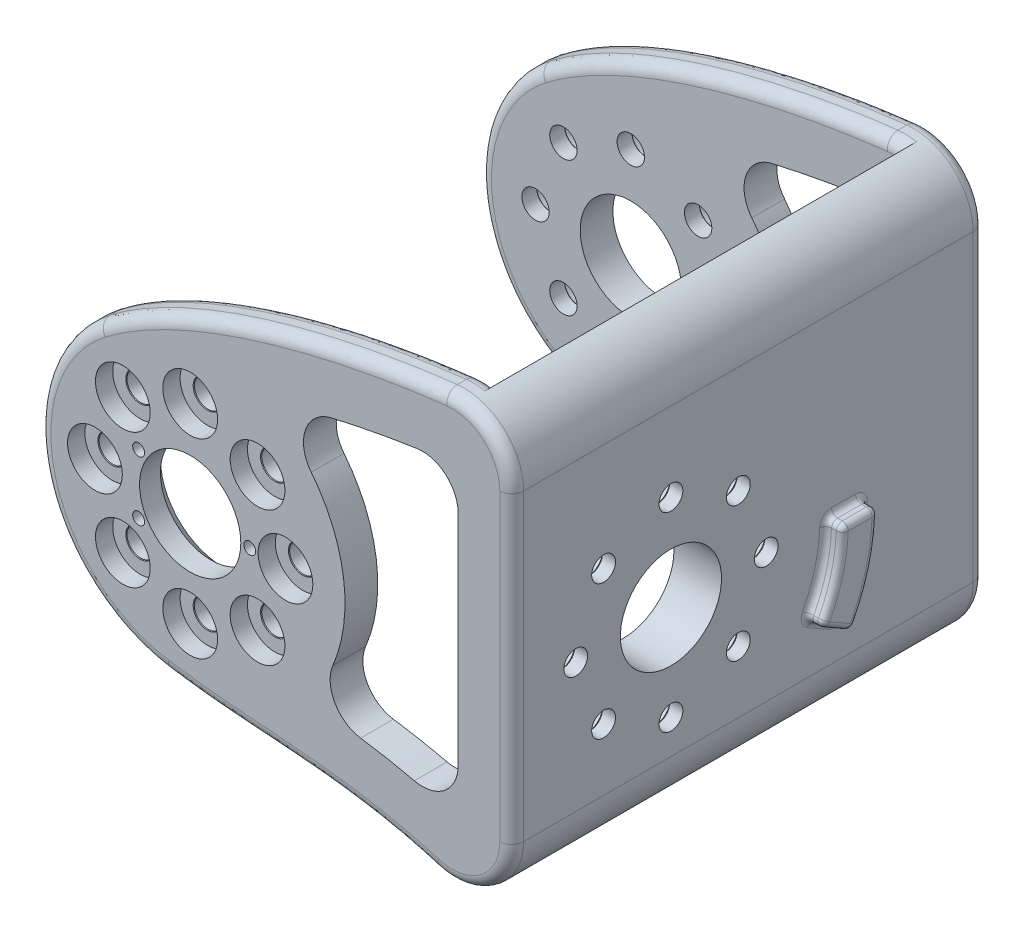
from build123d import *

# Parameters (mm, degrees)
BOSS_EXTRUDE1_DEPTH                          = 19.875
SHELL1_START                                 = -12.7000001
SHELL1_OUTLINE_W                             = 39
SHELL1_OUTLINE_H                             = 34.25
SHELL1_DEPTH                                 = 35.7000001
CBORE_FOR_M2_HEX_SOCKET_HEAD_CAP_SCR_2_COUNT = 2
CBORE_FOR_M2_HEX_SOCKET_HEAD_CAP_SCR_2_PITCH = 6.122934918
CBORE_FOR_M2_HEX_SOCKET_HEAD_CAP_SCR_3_COUNT = 2
CBORE_FOR_M2_HEX_SOCKET_HEAD_CAP_SCR_3_PITCH = 11.313708499
CBORE_FOR_M2_HEX_SOCKET_HEAD_CAP_SCR_4_COUNT = 2
CBORE_FOR_M2_HEX_SOCKET_HEAD_CAP_SCR_4_PITCH = 14.78207252
CBORE_FOR_M2_HEX_SOCKET_HEAD_CAP_SCR_5_COUNT = 2
CBORE_FOR_M2_HEX_SOCKET_HEAD_CAP_SCR_5_PITCH = 16
CBORE_FOR_M2_HEX_SOCKET_HEAD_CAP_SCR_6_COUNT = 2
CBORE_FOR_M2_HEX_SOCKET_HEAD_CAP_SCR_6_PITCH = 6.122934918
CBORE_FOR_M2_HEX_SOCKET_HEAD_CAP_SCR_7_COUNT = 2
CBORE_FOR_M2_HEX_SOCKET_HEAD_CAP_SCR_7_PITCH = 11.313708499
CBORE_FOR_M2_HEX_SOCKET_HEAD_CAP_SCR_8_COUNT = 2
CBORE_FOR_M2_HEX_SOCKET_HEAD_CAP_SCR_8_PITCH = 14.78207252
SKETCH27_R                                   = 0.5
CUT_EXTRUDE10_DEPTH                          = 1
CUT_EXTRUDE17_DEPTH                          = 40.038642886
CUT_EXTRUDE17_DEPTH_BACK                     = 40.038642886
SKETCH35_R                                   = 4.25
CUT_EXTRUDE4_REACH                           = 50.694
SKETCH10_R                                   = 4.25
SKETCH28_R                                   = 0.4
CUT_EXTRUDE11_DEPTH                          = 1
CUT_EXTRUDE15_DEPTH                          = 40.038642886
CUT_EXTRUDE15_DEPTH_BACK                     = 40.038642886
BOSS_EXTRUDE2_DEPTH                          = 1.4
FILLET34_R                                   = 5
FILLET36_R                                   = 0.5
FILLET30_R                                   = 3
CHAMFER1_SIZE                                = 1
FILLET35_R                                   = 1
FILLET37_R                                   = 0.5
POPY_WATERMARK_RIGHT_DEPTH                   = 1
SCALE1_SCALE                                 = 1.3
SCALE2_SCALE                                 = 1.05769


# Read off the part's stored shape, not the designer's step: Shell1, CBORE for M2 Hex Socket Head Cap Screw2
with BuildPart() as part:
    # Sketch4 → Boss-Extrude1 (new, symmetric)
    with BuildSketch(Plane.XY):
        with BuildLine():
            Line((27, -18), (27, 20))
            add(Edge.make_bspline(
                [(-7.730668476, 10.076049072), (2.170162487, 17.672284588), (21.370784375, 20), (27, 20)],
                knots=[0, 0, 0, 0, 1, 1, 1, 1], degree=3))
            ThreePointArc((-7.730668476, 10.076049072), (-12.308703382, -3.128229699), (-1.981723336, -12.544431937))
            add(Edge.make_bspline(
                [(-1.981723336, -12.544431937), (7.580415063, -14.055023481), (14.656713895, -12.657176609), (27, -18)],
                knots=[0, 0, 0, 0, 1, 1, 1, 1], degree=3))
        make_face()
    extrude(amount=BOSS_EXTRUDE1_DEPTH, both=True)

    # Shell1 outline → Shell1 (cut)
    with BuildSketch(Plane.YZ.offset(SHELL1_START)):
        with Locations((1.5, 0)):
            Rectangle(SHELL1_OUTLINE_W, SHELL1_OUTLINE_H)
    extrude(amount=SHELL1_DEPTH, mode=Mode.SUBTRACT)

    # Sketch5 → CBORE for M2 Hex Socket Head Cap Screw1 (revolve, cut)
    with BuildSketch(Plane(origin=(23, -5.656854249, 0.843145751), x_dir=(0, 0, 1), z_dir=(0, 1, 0))):
        Polygon((0, 0), (0, 4), (1, 4), (1, 2.9), (1.2, 2.7), (2.3, 2.7), (2.3, 0), align=None)
    cbore_for_m2_hex_socket_head_cap_screw1 = revolve(axis=Axis((16.65, -5.656854249, 0.843145751), (1, 0, 0)), mode=Mode.SUBTRACT)

    # CBORE for M2 Hex Socket Head Cap Scr 2: CBORE for M2 Hex Socket Head Cap Screw1 ×2
    with Locations(*[Vector(0, 0.923879532511287, -0.3826834323650894) * (i * CBORE_FOR_M2_HEX_SOCKET_HEAD_CAP_SCR_2_PITCH) for i in range(1, CBORE_FOR_M2_HEX_SOCKET_HEAD_CAP_SCR_2_COUNT)]):
        add(cbore_for_m2_hex_socket_head_cap_screw1, mode=Mode.SUBTRACT)

    # CBORE for M2 Hex Socket Head Cap Scr 3: CBORE for M2 Hex Socket Head Cap Screw1 ×2
    with Locations(*[(0, i * CBORE_FOR_M2_HEX_SOCKET_HEAD_CAP_SCR_3_PITCH, 0) for i in range(1, CBORE_FOR_M2_HEX_SOCKET_HEAD_CAP_SCR_3_COUNT)]):
        add(cbore_for_m2_hex_socket_head_cap_screw1, mode=Mode.SUBTRACT)

    # CBORE for M2 Hex Socket Head Cap Scr 4: CBORE for M2 Hex Socket Head Cap Screw1 ×2
    with Locations(*[Vector(0, 0.9238795325112865, 0.38268343236509034) * (i * CBORE_FOR_M2_HEX_SOCKET_HEAD_CAP_SCR_4_PITCH) for i in range(1, CBORE_FOR_M2_HEX_SOCKET_HEAD_CAP_SCR_4_COUNT)]):
        add(cbore_for_m2_hex_socket_head_cap_screw1, mode=Mode.SUBTRACT)

    # CBORE for M2 Hex Socket Head Cap Scr 5: CBORE for M2 Hex Socket Head Cap Screw1 ×2
    with Locations(*[Vector(0, 0.707106781186547, 0.707106781186548) * (i * CBORE_FOR_M2_HEX_SOCKET_HEAD_CAP_SCR_5_PITCH) for i in range(1, CBORE_FOR_M2_HEX_SOCKET_HEAD_CAP_SCR_5_COUNT)]):
        add(cbore_for_m2_hex_socket_head_cap_screw1, mode=Mode.SUBTRACT)

    # CBORE for M2 Hex Socket Head Cap Scr 6: CBORE for M2 Hex Socket Head Cap Screw1 ×2
    with Locations(*[Vector(0, -0.3826834323650897, 0.9238795325112868) * (i * CBORE_FOR_M2_HEX_SOCKET_HEAD_CAP_SCR_6_PITCH) for i in range(1, CBORE_FOR_M2_HEX_SOCKET_HEAD_CAP_SCR_6_COUNT)]):
        add(cbore_for_m2_hex_socket_head_cap_screw1, mode=Mode.SUBTRACT)

    # CBORE for M2 Hex Socket Head Cap Scr 7: CBORE for M2 Hex Socket Head Cap Screw1 ×2
    with Locations(*[(0, 0, i * CBORE_FOR_M2_HEX_SOCKET_HEAD_CAP_SCR_7_PITCH) for i in range(1, CBORE_FOR_M2_HEX_SOCKET_HEAD_CAP_SCR_7_COUNT)]):
        add(cbore_for_m2_hex_socket_head_cap_screw1, mode=Mode.SUBTRACT)

    # CBORE for M2 Hex Socket Head Cap Scr 8: CBORE for M2 Hex Socket Head Cap Screw1 ×2
    with Locations(*[Vector(0, 0.38268343236508934, 0.923879532511287) * (i * CBORE_FOR_M2_HEX_SOCKET_HEAD_CAP_SCR_8_PITCH) for i in range(1, CBORE_FOR_M2_HEX_SOCKET_HEAD_CAP_SCR_8_COUNT)]):
        add(cbore_for_m2_hex_socket_head_cap_screw1, mode=Mode.SUBTRACT)

    # CBORE for M2 Hex Socket Head Cap Scr 9 → CBORE for M2 Hex Socket Head Cap Screw2 (revolve, cut)
    with BuildSketch(Plane(origin=(-5.656854249, -5.656854249, 0), x_dir=(1, 0, 0), z_dir=(0, -1, 0))):
        Polygon((0, 17.125), (1.15, 17.125), (1.15, 18.375), (1.2, 18.425), (2.3, 18.425), (2.3, 19.875), (0, 19.875), align=None)
    cbore_for_m2_hex_socket_head_cap_screw2 = revolve(axis=Axis((-5.656854249, -5.656854249, 0), (0, 0, 1)), mode=Mode.SUBTRACT)

    # CBORE for M2 Hex Socket Head Cap Scr 11 → CBORE for M2 Hex Socket Head Cap Scr 10 (revolve, cut)
    with BuildSketch(Plane(origin=(-8, 0, 0), x_dir=(1, 0, 0), z_dir=(0, -1, 0))):
        Polygon((1.15, 18.375), (1.2, 18.425), (2.3, 18.425), (2.3, 19.875), (0, 19.875), (0, 17.125), (1.15, 17.125), align=None)
    cbore_for_m2_hex_socket_head_cap_scr_10 = revolve(axis=Axis((-8, 0, 0), (0, 0, 1)), mode=Mode.SUBTRACT)

    # CBORE for M2 Hex Socket Head Cap Scr 13 → CBORE for M2 Hex Socket Head Cap Scr 12 (revolve, cut)
    with BuildSketch(Plane(origin=(-5.656854249, 5.656854249, 0), x_dir=(1, 0, 0), z_dir=(0, -1, 0))):
        Polygon((1.15, 18.375), (1.2, 18.425), (2.3, 18.425), (2.3, 19.875), (0, 19.875), (0, 17.125), (1.15, 17.125), align=None)
    cbore_for_m2_hex_socket_head_cap_scr_12 = revolve(axis=Axis((-5.656854249, 5.656854249, 0), (0, 0, 1)), mode=Mode.SUBTRACT)

    # CBORE for M2 Hex Socket Head Cap Scr 15 → CBORE for M2 Hex Socket Head Cap Scr 14 (revolve, cut)
    with BuildSketch(Plane(origin=(8, 0, 0), x_dir=(1, 0, 0), z_dir=(0, -1, 0))):
        Polygon((1.15, 18.375), (1.2, 18.425), (2.3, 18.425), (2.3, 19.875), (0, 19.875), (0, 17.125), (1.15, 17.125), align=None)
    cbore_for_m2_hex_socket_head_cap_scr_14 = revolve(axis=Axis((8, 0, 0), (0, 0, 1)), mode=Mode.SUBTRACT)

    # CBORE for M2 Hex Socket Head Cap Scr 17 → CBORE for M2 Hex Socket Head Cap Scr 16 (revolve, cut)
    with BuildSketch(Plane(origin=(5.656854249, -5.656854249, 0), x_dir=(1, 0, 0), z_dir=(0, -1, 0))):
        Polygon((1.15, 18.375), (1.2, 18.425), (2.3, 18.425), (2.3, 19.875), (0, 19.875), (0, 17.125), (1.15, 17.125), align=None)
    cbore_for_m2_hex_socket_head_cap_scr_16 = revolve(axis=Axis((5.656854249, -5.656854249, 0), (0, 0, 1)), mode=Mode.SUBTRACT)

    # CBORE for M2 Hex Socket Head Cap Scr 19 → CBORE for M2 Hex Socket Head Cap Scr 18 (revolve, cut)
    with BuildSketch(Plane.XZ.offset(8)):
        Polygon((1.15, 18.375), (1.2, 18.425), (2.3, 18.425), (2.3, 19.875), (0, 19.875), (0, 17.125), (1.15, 17.125), align=None)
    cbore_for_m2_hex_socket_head_cap_scr_18 = revolve(axis=Axis((0, -8, 0), (0, 0, 1)), mode=Mode.SUBTRACT)

    # CBORE for M2 Hex Socket Head Cap Scr 21 → CBORE for M2 Hex Socket Head Cap Scr 20 (revolve, cut)
    with BuildSketch(Plane.XZ.offset(-8)):
        Polygon((1.15, 18.375), (1.2, 18.425), (2.3, 18.425), (2.3, 19.875), (0, 19.875), (0, 17.125), (1.15, 17.125), align=None)
    cbore_for_m2_hex_socket_head_cap_scr_20 = revolve(axis=Axis((0, 8, 0), (0, 0, 1)), mode=Mode.SUBTRACT)

    # CBORE for M2 Hex Socket Head Cap Scr 23 → CBORE for M2 Hex Socket Head Cap Scr 22 (revolve, cut)
    with BuildSketch(Plane(origin=(5.656854249, 5.656854249, 0), x_dir=(1, 0, 0), z_dir=(0, -1, 0))):
        Polygon((1.15, 18.375), (1.2, 18.425), (2.3, 18.425), (2.3, 19.875), (0, 19.875), (0, 17.125), (1.15, 17.125), align=None)
    cbore_for_m2_hex_socket_head_cap_scr_22 = revolve(axis=Axis((5.656854249, 5.656854249, 0), (0, 0, 1)), mode=Mode.SUBTRACT)

    # Sketch27 → Cut-Extrude10 (cut)
    with BuildSketch(Plane.XY.offset(19.875)):
        with Locations((-4.330127019, -2.5)):
            Circle(SKETCH27_R)
        with Locations((-4.330127019, 2.5)):
            Circle(SKETCH27_R)
        with Locations((5, 0)):
            Circle(SKETCH27_R)
    extrude(amount=-CUT_EXTRUDE10_DEPTH, mode=Mode.SUBTRACT)

    # Mirror2: CBORE for M2 Hex Socket Head Cap Screw2, CBORE for M2 Hex Socket Head Cap Scr 10, CBORE for M2 Hex Socket Head Cap Scr 12, CBORE for M2 Hex Socket Head Cap Scr 14, CBORE for M2 Hex Socket Head Cap Scr 16, CBORE for M2 Hex Socket Head Cap Scr 18, CBORE for M2 Hex Socket Head Cap Scr 20, CBORE for M2 Hex Socket Head Cap Scr 22 across plane
    add(cbore_for_m2_hex_socket_head_cap_screw2.mirror(Plane.XY), mode=Mode.SUBTRACT)
    add(cbore_for_m2_hex_socket_head_cap_scr_10.mirror(Plane.XY), mode=Mode.SUBTRACT)
    add(cbore_for_m2_hex_socket_head_cap_scr_12.mirror(Plane.XY), mode=Mode.SUBTRACT)
    add(cbore_for_m2_hex_socket_head_cap_scr_14.mirror(Plane.XY), mode=Mode.SUBTRACT)
    add(cbore_for_m2_hex_socket_head_cap_scr_16.mirror(Plane.XY), mode=Mode.SUBTRACT)
    add(cbore_for_m2_hex_socket_head_cap_scr_18.mirror(Plane.XY), mode=Mode.SUBTRACT)
    add(cbore_for_m2_hex_socket_head_cap_scr_20.mirror(Plane.XY), mode=Mode.SUBTRACT)
    add(cbore_for_m2_hex_socket_head_cap_scr_22.mirror(Plane.XY), mode=Mode.SUBTRACT)

    # Sketch35 → Cut-Extrude17 (cut, two sides: drawn at the far end of the back side and taken through both)
    with BuildSketch(Plane.XY.offset(-CUT_EXTRUDE17_DEPTH_BACK)):
        Circle(SKETCH35_R)
    extrude(amount=CUT_EXTRUDE17_DEPTH + CUT_EXTRUDE17_DEPTH_BACK, mode=Mode.SUBTRACT)

    # Sketch10 → Cut-Extrude4 (cut, up to next)
    with BuildSketch(Plane(origin=(27, 0, 0), x_dir=(0, 0, -1), z_dir=(1, 0, 0)), mode=Mode.PRIVATE) as cut_extrude4_sk1:
        with Locations((-6.5, 0)):
            Circle(SKETCH10_R)
    cut_extrude4_tool1 = extrude(cut_extrude4_sk1.sketch, amount=-CUT_EXTRUDE4_REACH, mode=Mode.PRIVATE) & part.part
    add(cut_extrude4_tool1.solids().sort_by_distance((27, 0, 6.5))[0], mode=Mode.SUBTRACT)

    # Sketch28 → Cut-Extrude11 (cut)
    with BuildSketch(Plane.ZY.offset(-23)):
        with Locations((4, 4.330127019)):
            Circle(SKETCH28_R)
        with Locations((6.5, -5)):
            Circle(SKETCH28_R)
        with Locations((9, 4.330127019)):
            Circle(SKETCH28_R)
    extrude(amount=-CUT_EXTRUDE11_DEPTH, mode=Mode.SUBTRACT)

    # Sketch33 → Cut-Extrude15 (cut, two sides: drawn at the far end of the back side and taken through both)
    with BuildSketch(Plane.XY.offset(-CUT_EXTRUDE15_DEPTH_BACK)):
        with BuildLine():
            Line((22.5, -11.00441019), (22.5, 14.703770704))
            add(Edge.make_bspline(
                [(22.5, 14.703770704), (19.97823315, 14.435188006), (17.478569984, 14.052501286), (13.840120773, 13.34454419), (12.686377133, 13.096488181), (10.388606277, 12.550217869), (9.243374868, 12.25169122), (7.498636488, 11.749344215), (6.894320921, 11.566457955), (6.293948625, 11.374805964)],
                knots=[-0.017703057, -0.017703057, -0.017703057, -0.017703057, 0.25, 0.25, 0.375, 0.375, 0.5, 0.5, 0.566833748, 0.566833748, 0.566833748, 0.566833748], degree=3))
            ThreePointArc((6.293948625, 11.374805964), (12.814173522, 2.190195644), (9.71463917, -8.638621754))
            add(Edge.make_bspline(
                [(9.71463917, -8.638621754), (9.975309464, -8.661139726), (10.235894851, -8.684549682), (12.446027973, -8.892631092), (14.383905745, -9.13940269), (18.390999465, -9.872923338), (20.457026256, -10.376791909), (22.5, -11.00441019)],
                knots=[0.46659928, 0.46659928, 0.46659928, 0.46659928, 0.5, 0.5, 0.75, 0.75, 1.022184537, 1.022184537, 1.022184537, 1.022184537], degree=3))
        make_face()
    extrude(amount=CUT_EXTRUDE15_DEPTH + CUT_EXTRUDE15_DEPTH_BACK, mode=Mode.SUBTRACT)

    # Sketch21 → Boss-Extrude2 (add)
    with BuildSketch(Plane(origin=(27, 0, 0), x_dir=(0, 0, -1), z_dir=(1, 0, 0))):
        with BuildLine():
            Line((9.5, 0), (6.5, 0))
            ThreePointArc((6.5, 0), (6.057035742, -3.364647586), (4.758330249, -6.5))
            Line((4.758330249, -6.5), (7.356406461, -8))
            ThreePointArc((7.356406461, -8), (8.954813221, -4.141104722), (9.5, 0))
        make_face()
    extrude(amount=BOSS_EXTRUDE2_DEPTH)

    # Fillet34
    # the kernel refuses this fillet: 5 mm, written as the material it takes off along each edge
    with BuildSketch(Plane(origin=(27, 20, 0), x_dir=(-0.9976427256817361, -0.06862209479691335, 0), z_dir=(0, 0, 1))) as fillet34_piece_1:
        with BuildLine():
            CenterArc((5.355410859, 4.99528158), FILLET34_R, 176.065151261, 96.424193771)
            Line((0.36719723, 5.338392054), (0.267432958, 5.345254263))
            Line((0.267432958, 5.345254263), (-0.099764273, 0.006862209))
            Line((-0.099764273, 0.006862209), (-0.006862209, -0.099764273))
            ThreePointArc((-0.006862209, -0.099764273), (2.787150186, -0.170501246), (5.576922215, -0.099905632))
            Line((5.576922215, -0.099905632), (5.572578855, 0))
        make_face()
    extrude(amount=33.806447138, mode=Mode.SUBTRACT)
    with BuildSketch(Plane(origin=(27, -18, 0), x_dir=(-0.9389575181326852, 0.34403310762498984, 0), z_dir=(0, 0, 1))) as fillet34_piece_2:
        with BuildLine():
            CenterArc((7.153450392, -4.990176783), FILLET34_R, 93.592118164, 106.530666076)
            Line((2.458662802, -6.710342322), (2.36476705, -6.744745632))
            Line((2.36476705, -6.744745632), (-0.093895752, -0.034403311))
            Line((-0.093895752, -0.034403311), (0.005726284, 0.099835914))
            ThreePointArc((0.005726284, 0.099835914), (3.420088275, -0.002804221), (6.833918938, 0.099803536))
            Line((6.833918938, 0.099803536), (6.84018426, 0))
        make_face()
    extrude(amount=37.741469441, mode=Mode.SUBTRACT)
    with BuildSketch(Plane(origin=(27, -18, 0), x_dir=(0, 1, 0), z_dir=(0, 0, -1))) as fillet34_piece_3:
        with BuildLine():
            CenterArc((7.146587776, -5), FILLET34_R, 90, 106.530666076)
            Line((2.353249848, -6.422642437), (2.257383089, -6.451095285))
            ThreePointArc((2.257383089, -6.451095285), (1.179256642, -3.210352854), (-0.091771651, -0.039723597))
            Line((-0.091771651, -0.039723597), (0, 0.1))
            Line((0, 0.1), (7.146587776, 0.1))
            Line((7.146587776, 0.1), (7.146587776, 0))
        make_face()
    extrude(amount=37.741469441, mode=Mode.SUBTRACT)
    with BuildSketch(Plane(origin=(27, 20, 0), x_dir=(0, -1, 0), z_dir=(0, 0, -1))) as fillet34_piece_4:
        with BuildLine():
            CenterArc((5.351005842, 5), FILLET34_R, 173.575806229, 96.424193771)
            Line((0.382402034, 5.559442758), (0.283029958, 5.570631613))
            ThreePointArc((0.283029958, 5.570631613), (0.021160756, 2.792280262), (-0.1, 0))
            Line((-0.1, 0), (0, -0.1))
            Line((0, -0.1), (5.351005842, -0.1))
            Line((5.351005842, -0.1), (5.351005842, 0))
        make_face()
    extrude(amount=33.806447138, mode=Mode.SUBTRACT)

    # Fillet36
    fillet36_edges = [part.edges().sort_by_distance(p)[0] for p in [
        (27.7, 0, -9.5),
        (27.7, -8, -7.356406461),
        (27.7, 0, -6.5),
        (27.7, -6.5, -4.758330249),
    ]]
    fillet(fillet36_edges, radius=FILLET36_R)

    # Fillet30
    fillet30_edges = [part.edges().sort_by_distance(p)[0] for p in [
        (6.293948625, 11.374805964, 18.5),
        (9.71463917, -8.638621754, 18.5),
        (22.5, 14.703770704, 18.5),
        (22.5, -11.00441019, 18.5),
        (9.71463917, -8.638621754, -18.5),
        (22.5, -11.00441019, -18.5),
        (6.293948625, 11.374805964, -18.5),
        (22.5, 14.703770704, -18.5),
    ]]
    fillet(fillet30_edges, radius=FILLET30_R)

    # Chamfer1
    chamfer1_edges = [part.edges().sort_by_distance(p)[0] for p in [
        (-4.25, 0, 17.125),
    ]]
    chamfer(chamfer1_edges, length=CHAMFER1_SIZE)

    # Fillet35
    fillet35_edges = [part.edges().sort_by_distance(p)[0] for p in [
        (-12.308703382, -3.128229699, -19.875),
        (9.370960012, -13.627485217, -17.125),
        (-12.308703382, -3.128229699, -17.125),
        (9.370960012, -13.627485217, 17.125),
        (-12.308703382, -3.128229699, 17.125),
        (27, 1.897790967, 19.875),
        (27, 1.897790967, -19.875),
        (6.250340148, 16.591351102, 19.875),
        (24.99055077, -14.860481738, 19.875),
        (25.331875313, 18.3770777, 19.875),
        (6.250340147, 16.591351097, 17.125),
        (6.250340148, 16.591351102, -19.875),
        (6.250340147, 16.591351097, -17.125),
        (21.782177384, -15.848665301, 17.125),
        (22.22301246, 19.644018226, 17.125),
        (21.782177384, -15.848665301, -17.125),
        (22.22301246, 19.644018226, -17.125),
        (24.99055077, -14.860481738, -19.875),
        (25.331875313, 18.3770777, -19.875),
        (9.370960013, -13.627485199, -19.875),
        (-12.308703382, -3.128229699, 19.875),
        (9.370960013, -13.627485199, 19.875),
    ]]
    fillet(fillet35_edges, radius=FILLET35_R)

    # Fillet37
    fillet37_edges = [part.edges().sort_by_distance(p)[0] for p in [
        (27, -4.141104722, -8.954813221),
        (28.4, -4.141104722, -8.954813221),
        (28.4, -7.245667737, -6.049864655),
        (28.4, 0, -7.991335474),
        (28.4, -3.364647586, -6.057035742),
        (28.4, -7.793766541, -7.303591288),
        (28.4, -6.450688695, -4.952838264),
        (28.4, -0.13995885, -6.64379323),
        (28.4, -0.152195828, -9.351143989),
        (27, 0, -7.991335474),
        (27, -3.364647586, -6.057035742),
        (27, -7.245667737, -6.049864655),
        (27, -0.152195828, -9.351143989),
        (27, -0.13995885, -6.64379323),
        (27, -6.450688695, -4.952838264),
        (27, -7.793766541, -7.303591288),
    ]]
    fillet(fillet37_edges, radius=FILLET37_R)

    # Sketch37 → Popy_watermark_right (cut)
    # profile 1 of 7: a face of its own
    with BuildSketch(Plane.ZY.offset(-23)):
        with BuildLine():
            Line((-13.718565077, -12.870992065), (-13.718565077, -8.870992065))
            Line((-13.718565077, -8.870992065), (-12.438917641, -8.870992065))
            add(Edge.make_bspline(
                [(-12.438917641, -8.870992065), (-12.380956345, -8.871055361), (-12.270098475, -8.871176423), (-12.11196643, -8.874540034), (-11.969592214, -8.879301595), (-11.843187133, -8.885231918), (-11.732306401, -8.894081099), (-11.637447418, -8.904328318), (-11.558012861, -8.915351606), (-11.511236203, -8.926759235), (-11.490199692, -8.931889501)],
                knots=[0, 0, 0, 0, 1.460485487, 2.793352117, 3.985295279, 5.050041172, 5.981765236, 6.787433016, 7.454681457, 8, 8, 8, 8], degree=3))
            add(Edge.make_bspline(
                [(-11.490199692, -8.931889501), (-11.462226248, -8.939865808), (-11.406705516, -8.955696908), (-11.327161619, -8.989446299), (-11.250493899, -9.028560044), (-11.177665602, -9.075176556), (-11.108429164, -9.128468231), (-11.04257878, -9.188000465), (-10.979763281, -9.254042001), (-10.920851638, -9.326462378), (-10.866895503, -9.404896414), (-10.820263846, -9.489460072), (-10.781196267, -9.579785795), (-10.74791134, -9.675194797), (-10.723353562, -9.776710017), (-10.706167582, -9.883626116), (-10.694203995, -9.995989855), (-10.693356936, -10.072882435), (-10.692924051, -10.112177962)],
                knots=[0, 0, 0, 0, 0.907145743, 1.80047177, 2.69161667, 3.591261238, 4.495029544, 5.415863088, 6.359363025, 7.337192411, 8.326890979, 9.326929023, 10.346104993, 11.395420813, 12.477187422, 13.601053412, 14.774031606, 16, 16, 16, 16], degree=3))
            add(Edge.make_bspline(
                [(-10.692924051, -10.112177962), (-10.694158636, -10.171852689), (-10.696535281, -10.286729813), (-10.723125713, -10.451420095), (-10.763682664, -10.601854051), (-10.822959577, -10.736582689), (-10.895230449, -10.856134707), (-10.974838302, -10.963910288), (-11.065738772, -11.056660964), (-11.16394871, -11.135883562), (-11.267738666, -11.20071605), (-11.371716503, -11.255984825), (-11.477285249, -11.298477226), (-11.549261786, -11.316991506), (-11.584750974, -11.32612027)],
                knots=[0, 0, 0, 0, 1.312386234, 2.526415563, 3.661883817, 4.733421185, 5.753802465, 6.732107337, 7.675884281, 8.604170108, 9.50284679, 10.365392406, 11.194030444, 12, 12, 12, 12], degree=3))
            add(Edge.make_bspline(
                [(-11.584750974, -11.32612027), (-11.610081417, -11.330938715), (-11.663474967, -11.341095423), (-11.748153943, -11.351219813), (-11.840712653, -11.362426408), (-11.941531797, -11.369735979), (-12.050489411, -11.376581086), (-12.167543186, -11.379812886), (-12.292525839, -11.38370655), (-12.378550535, -11.383776515), (-12.422892, -11.383812578)],
                knots=[0, 0, 0, 0, 0.735353946, 1.55003838, 2.431865514, 3.394945452, 4.432993119, 5.54609699, 6.735134699, 8, 8, 8, 8], degree=3))
            Line((-12.422892, -11.383812578), (-12.949334308, -11.383812578))
            Line((-12.949334308, -11.383812578), (-12.949334308, -12.870992065))
            Line((-12.949334308, -12.870992065), (-13.718565077, -12.870992065))
        make_face()
        with BuildLine():
            Line((-12.949334308, -9.537658732), (-12.949334308, -10.717145911))
            Line((-12.949334308, -10.717145911), (-12.487795846, -10.717145911))
            add(Edge.make_bspline(
                [(-12.487795846, -10.717145911), (-12.447995342, -10.717094373), (-12.37185197, -10.716995773), (-12.262603122, -10.713456639), (-12.163710961, -10.709136469), (-12.074968856, -10.701985704), (-11.996912477, -10.692561167), (-11.9290191, -10.681288233), (-11.871209597, -10.669191198), (-11.80869649, -10.649144471), (-11.741857479, -10.616710696), (-11.670481271, -10.570095214), (-11.607777356, -10.514360907), (-11.555599388, -10.448902894), (-11.513920744, -10.37617525), (-11.484078804, -10.29692331), (-11.464809892, -10.212460557), (-11.463049852, -10.153951018), (-11.46215482, -10.124197193)],
                knots=[0, 0, 0, 0, 1.411705958, 2.700771114, 3.876961699, 4.922619712, 5.858038221, 6.66485904, 7.363650596, 7.950905807, 8.989198271, 9.987739806, 10.967313358, 11.951275539, 12.944273208, 13.927870418, 14.946261014, 16, 16, 16, 16], degree=3))
            add(Edge.make_bspline(
                [(-11.46215482, -10.124197193), (-11.46341448, -10.087957498), (-11.465856793, -10.017693509), (-11.492788692, -9.917625861), (-11.534341533, -9.826813257), (-11.5937503, -9.748081288), (-11.665514692, -9.681874176), (-11.746174873, -9.626787506), (-11.837453379, -9.588237434), (-11.902054094, -9.573300704), (-11.934911231, -9.565703603)],
                knots=[0, 0, 0, 0, 1.085904563, 2.105425768, 3.088705091, 4.068969419, 5.045188284, 6.010769642, 6.988240112, 8, 8, 8, 8], degree=3))
            add(Edge.make_bspline(
                [(-11.934911231, -9.565703603), (-11.949050407, -9.563442157), (-11.980434995, -9.558422448), (-12.032602567, -9.553183758), (-12.094316813, -9.548419174), (-12.165652124, -9.544507308), (-12.246325744, -9.541449135), (-12.33660377, -9.538769421), (-12.43624844, -9.538554142), (-12.505958892, -9.537965471), (-12.542283026, -9.537658732)],
                knots=[0, 0, 0, 0, 0.564603001, 1.253243608, 2.066786758, 3.005752288, 4.070476343, 5.250658742, 6.567396469, 8, 8, 8, 8], degree=3))
            Line((-12.542283026, -9.537658732), (-12.949334308, -9.537658732))
        make_face(mode=Mode.SUBTRACT)
    # profile 2 of 7: a face of its own
    with BuildSketch(Plane.ZY.offset(-23)):
        with BuildLine():
            add(Edge.make_bspline(
                [(-10.23138559, -11.368588219), (-10.228917646, -11.305412581), (-10.223976974, -11.178938848), (-10.188686395, -10.991068737), (-10.12895156, -10.806969943), (-10.06208764, -10.657599514), (-9.9960661, -10.543406839), (-9.942749496, -10.461061902), (-9.883227323, -10.384903177), (-9.818717839, -10.314448034), (-9.750672164, -10.248007437), (-9.676694317, -10.188025566), (-9.59774109, -10.133468839), (-9.5145834, -10.0837354), (-9.427340127, -10.040068087), (-9.337630956, -10.00125228), (-9.245093367, -9.969358776), (-9.150372101, -9.942910122), (-9.053056425, -9.921697362), (-8.953119499, -9.907809047), (-8.850682348, -9.898548377), (-8.781620017, -9.897277395), (-8.746609949, -9.89663309)],
                knots=[0, 0, 0, 0, 1.619840069, 3.242819969, 4.882696853, 6.574901176, 7.427927767, 8.263869039, 9.088735507, 9.903385011, 10.712399333, 11.525463381, 12.34252837, 13.171904741, 14.008210778, 14.842888174, 15.67691885, 16.516221154, 17.363978437, 18.229048737, 19.10224397, 20, 20, 20, 20], degree=3))
            add(Edge.make_bspline(
                [(-8.746609949, -9.89663309), (-8.69339516, -9.897771182), (-8.588710786, -9.900010042), (-8.435458767, -9.920403417), (-8.289766527, -9.954001058), (-8.151437454, -10.0007827), (-8.020367283, -10.060753114), (-7.897215314, -10.135295405), (-7.780964078, -10.222222545), (-7.673813854, -10.322064742), (-7.575873606, -10.431385949), (-7.490930862, -10.54957248), (-7.418431119, -10.674338116), (-7.358385313, -10.805881203), (-7.312806836, -10.944895938), (-7.28131868, -11.091042028), (-7.260233243, -11.243777404), (-7.258109121, -11.348216157), (-7.257026615, -11.401440783)],
                knots=[0, 0, 0, 0, 1.076054793, 2.116819909, 3.120736197, 4.09633837, 5.065772102, 6.030360709, 7.002891056, 7.996945094, 8.988102315, 9.967288529, 10.93568283, 11.902870597, 12.887008047, 13.888537105, 14.923945207, 16, 16, 16, 16], degree=3))
            add(Edge.make_bspline(
                [(-7.257026615, -11.401440783), (-7.258113432, -11.455197127), (-7.26024098, -11.560430328), (-7.281200862, -11.714583905), (-7.313611128, -11.862021725), (-7.360119999, -12.002444723), (-7.420037102, -12.135691794), (-7.492221741, -12.262218071), (-7.578586176, -12.381358158), (-7.677474712, -12.491870308), (-7.786009117, -12.592258909), (-7.901425491, -12.681502717), (-8.025116469, -12.755075833), (-8.154912302, -12.816942863), (-8.292148393, -12.863892659), (-8.436042859, -12.897381277), (-8.586485977, -12.919222219), (-8.689374077, -12.921243925), (-8.741802256, -12.922274116)],
                knots=[0, 0, 0, 0, 1.084306555, 2.122634113, 3.133511532, 4.127271514, 5.10202058, 6.077484774, 7.061903265, 8.065960046, 9.065303363, 10.042062392, 11.004391854, 11.964060687, 12.939122686, 13.924942149, 14.942623041, 16, 16, 16, 16], degree=3))
            add(Edge.make_bspline(
                [(-8.741802256, -12.922274116), (-8.80711679, -12.92013453), (-8.937281124, -12.915870582), (-9.129896972, -12.880895717), (-9.317755114, -12.824465415), (-9.469102888, -12.759512099), (-9.584715976, -12.696174041), (-9.666705795, -12.642858138), (-9.744029538, -12.585640303), (-9.814877964, -12.521577846), (-9.880473831, -12.452510296), (-9.941686104, -12.379106385), (-9.996335223, -12.29967179), (-10.045947615, -12.215649695), (-10.090465411, -12.126439553), (-10.127577397, -12.031796284), (-10.159820936, -11.932831542), (-10.186414343, -11.829320599), (-10.206133128, -11.720819605), (-10.220470613, -11.607676218), (-10.229455216, -11.489725687), (-10.230734128, -11.409469652), (-10.23138559, -11.368588219)],
                knots=[0, 0, 0, 0, 1.610846835, 3.210231987, 4.81374032, 6.443368681, 7.263437361, 8.06418174, 8.855100662, 9.634539345, 10.417731031, 11.204243685, 11.990424874, 12.794120493, 13.610605693, 14.447765341, 15.300248309, 16.177865431, 17.082777535, 18.019649293, 18.991233806, 20, 20, 20, 20], degree=3))
        make_face()
        with BuildLine():
            add(Edge.make_bspline(
                [(-9.46215482, -11.409453603), (-9.461584719, -11.446603932), (-9.460475302, -11.518898481), (-9.450587403, -11.624082492), (-9.435261669, -11.722856317), (-9.411594471, -11.814301755), (-9.383054152, -11.899654526), (-9.346825328, -11.977779428), (-9.305427438, -12.050156062), (-9.256159323, -12.114077037), (-9.202461856, -12.17065989), (-9.146181698, -12.220936945), (-9.08676684, -12.263747514), (-9.023852355, -12.298553597), (-8.957516011, -12.324976892), (-8.888540671, -12.344366158), (-8.816430265, -12.355756779), (-8.767483139, -12.357357774), (-8.742603538, -12.358171552)],
                knots=[0, 0, 0, 0, 1.334287467, 2.596523749, 3.792235791, 4.920928783, 5.98599801, 7.020725633, 8.009778093, 8.975087571, 9.91178927, 10.809031968, 11.682407688, 12.537028737, 13.385161363, 14.241880569, 15.106355953, 16, 16, 16, 16], degree=3))
            add(Edge.make_bspline(
                [(-8.742603538, -12.358171552), (-8.71772286, -12.357360445), (-8.668773612, -12.355764705), (-8.596678674, -12.344335773), (-8.527884624, -12.325155964), (-8.461977906, -12.298337691), (-8.399226205, -12.263779109), (-8.339848344, -12.220908292), (-8.283608777, -12.170867264), (-8.230347971, -12.113979135), (-8.182505278, -12.049187784), (-8.140701716, -11.977037096), (-8.10447401, -11.898613139), (-8.075801822, -11.812807642), (-8.053431716, -11.720309801), (-8.037743747, -11.620894435), (-8.027935664, -11.514618727), (-8.026828295, -11.441527345), (-8.026257385, -11.403844629)],
                knots=[0, 0, 0, 0, 0.891374549, 1.753654511, 2.608197993, 3.445305504, 4.297756158, 5.168913853, 6.063877914, 6.991658187, 7.956416983, 8.942957645, 9.975057474, 11.046479855, 12.179282068, 13.381405243, 14.649967197, 16, 16, 16, 16], degree=3))
            add(Edge.make_bspline(
                [(-8.026257385, -11.403844629), (-8.026831129, -11.366963564), (-8.027943288, -11.295472415), (-8.037696073, -11.191581639), (-8.053646097, -11.094090666), (-8.075630227, -11.003097877), (-8.104622827, -10.918447844), (-8.140928545, -10.840923508), (-8.18223041, -10.768982787), (-8.23062763, -10.704869428), (-8.283574951, -10.648015034), (-8.339857012, -10.598005298), (-8.399223962, -10.555126446), (-8.461978489, -10.520569945), (-8.527884466, -10.493751126), (-8.596678717, -10.474571466), (-8.668773601, -10.463142494), (-8.717722856, -10.461546759), (-8.742603538, -10.460735655)],
                knots=[0, 0, 0, 0, 1.332105243, 2.582185114, 3.76554119, 4.898206757, 5.96011018, 6.991864232, 7.986448439, 8.951336849, 9.886681577, 10.788942532, 11.667203022, 12.526603947, 13.370536632, 14.232047448, 15.101357822, 16, 16, 16, 16], degree=3))
            add(Edge.make_bspline(
                [(-8.742603538, -10.460735655), (-8.767483139, -10.461549433), (-8.816430265, -10.463150428), (-8.888540671, -10.474541049), (-8.957516011, -10.493930315), (-9.023852355, -10.52035361), (-9.08676684, -10.555159693), (-9.146181698, -10.597970262), (-9.202461856, -10.648247316), (-9.256159323, -10.70483017), (-9.305427438, -10.768751145), (-9.346825328, -10.841127779), (-9.383054152, -10.919252681), (-9.411594471, -11.004605451), (-9.435261669, -11.096050889), (-9.450587403, -11.194824715), (-9.460475302, -11.300008726), (-9.461584719, -11.372303275), (-9.46215482, -11.409453603)],
                knots=[0, 0, 0, 0, 0.893644047, 1.758119431, 2.614838637, 3.462971263, 4.317592312, 5.190968032, 6.08821073, 7.024912429, 7.990221907, 8.979274367, 10.01400199, 11.079071217, 12.207764209, 13.403476251, 14.665712533, 16, 16, 16, 16], degree=3))
        make_face(mode=Mode.SUBTRACT)
    # profile 3 of 7: a face of its own
    with BuildSketch(Plane.ZY.offset(-23)):
        with BuildLine():
            Line((-6.641642, -9.947915142), (-5.872411231, -9.947915142))
            Line((-5.872411231, -9.947915142), (-5.872411231, -10.369389501))
            add(Edge.make_bspline(
                [(-5.872411231, -10.369389501), (-5.849518872, -10.334549835), (-5.803858821, -10.265060233), (-5.719639504, -10.172498959), (-5.623078926, -10.092082182), (-5.51692377, -10.022341587), (-5.401587608, -9.965982062), (-5.278894004, -9.926003075), (-5.150133533, -9.900997439), (-5.06216286, -9.898103973), (-5.017443282, -9.89663309)],
                knots=[0, 0, 0, 0, 0.978547196, 1.95176541, 2.927409496, 3.924956672, 4.929940552, 5.934297003, 6.949907262, 8, 8, 8, 8], degree=3))
            add(Edge.make_bspline(
                [(-5.017443282, -9.89663309), (-4.978373378, -9.897891266), (-4.90113015, -9.900378743), (-4.787704758, -9.919373492), (-4.678435912, -9.94978973), (-4.573713242, -9.99329546), (-4.473959491, -10.049963494), (-4.378931323, -10.118552667), (-4.288604576, -10.199542635), (-4.203640833, -10.292125676), (-4.124375624, -10.394891866), (-4.057826306, -10.509765575), (-3.999018533, -10.632850036), (-3.953487763, -10.766792491), (-3.915997789, -10.909654428), (-3.891439753, -11.06263555), (-3.874489382, -11.224776202), (-3.873116126, -11.336222348), (-3.872411231, -11.393427962)],
                knots=[0, 0, 0, 0, 0.889072898, 1.757743299, 2.610499059, 3.466435503, 4.33224962, 5.216506485, 6.129460723, 7.089031016, 8.074077693, 9.077254728, 10.105421072, 11.174607073, 12.292478541, 13.464028743, 14.698278956, 16, 16, 16, 16], degree=3))
            add(Edge.make_bspline(
                [(-3.872411231, -11.393427962), (-3.873479497, -11.45222802), (-3.875557075, -11.566583106), (-3.891863221, -11.732855206), (-3.917819824, -11.889165882), (-3.955398829, -12.035642125), (-4.004218822, -12.172194474), (-4.063588723, -12.298706029), (-4.133585473, -12.415280377), (-4.214591455, -12.520341837), (-4.302332255, -12.614785679), (-4.395588013, -12.697181879), (-4.493691952, -12.766458332), (-4.596363181, -12.823157835), (-4.703627597, -12.86742585), (-4.815279563, -12.899858289), (-4.931882945, -12.918470901), (-5.010968327, -12.920993912), (-5.051097128, -12.922274116)],
                knots=[0, 0, 0, 0, 1.306236862, 2.540385766, 3.708203967, 4.823704503, 5.895540064, 6.92555389, 7.923968911, 8.910318051, 9.867658815, 10.784332462, 11.670135407, 12.530710628, 13.384816116, 14.243178637, 15.10856933, 16, 16, 16, 16], degree=3))
            add(Edge.make_bspline(
                [(-5.051097128, -12.922274116), (-5.089119632, -12.921426075), (-5.163766685, -12.919761173), (-5.272603466, -12.899816442), (-5.376906926, -12.871969107), (-5.476734464, -12.828986382), (-5.574327111, -12.771508793), (-5.672786543, -12.698101537), (-5.7737148, -12.608139251), (-5.838493313, -12.539265684), (-5.872411231, -12.503203603)],
                knots=[0, 0, 0, 0, 0.955731574, 1.876324221, 2.77664122, 3.668156465, 4.602053939, 5.621192777, 6.754460664, 8, 8, 8, 8], degree=3))
            Line((-5.872411231, -12.503203603), (-5.872411231, -13.947915142))
            Line((-5.872411231, -13.947915142), (-6.641642, -13.947915142))
            Line((-6.641642, -13.947915142), (-6.641642, -9.947915142))
        make_face()
        with BuildLine():
            add(Edge.make_bspline(
                [(-5.872411231, -11.359774116), (-5.8716837, -11.400917803), (-5.870274472, -11.480613161), (-5.862669304, -11.595970656), (-5.84854749, -11.703141299), (-5.827302937, -11.801729076), (-5.802560643, -11.8927574), (-5.770083165, -11.974947776), (-5.732848615, -12.049148161), (-5.689152616, -12.114288809), (-5.641635281, -12.171512829), (-5.591350007, -12.221090051), (-5.538661694, -12.263569373), (-5.483358188, -12.298277446), (-5.425037197, -12.324779828), (-5.364389422, -12.344483347), (-5.300972898, -12.355647279), (-5.257868685, -12.357326925), (-5.236193282, -12.358171552)],
                knots=[0, 0, 0, 0, 1.493314022, 2.892550594, 4.193549699, 5.412205958, 6.550654332, 7.612709232, 8.614154521, 9.557822924, 10.452682187, 11.309508678, 12.116407821, 12.904513946, 13.672267114, 14.435601522, 15.213325928, 16, 16, 16, 16], degree=3))
            add(Edge.make_bspline(
                [(-5.236193282, -12.358171552), (-5.215315912, -12.357628386), (-5.174091554, -12.356555853), (-5.113761518, -12.345861997), (-5.056119416, -12.328142139), (-5.001492414, -12.302849899), (-4.94893599, -12.271724323), (-4.899755454, -12.232550956), (-4.853419798, -12.186800233), (-4.809418707, -12.134023624), (-4.769463178, -12.073265906), (-4.734653855, -12.003391874), (-4.706428843, -11.924391197), (-4.682237258, -11.836869528), (-4.664288553, -11.740045417), (-4.650762478, -11.634667026), (-4.642705568, -11.520156003), (-4.642005714, -11.440983952), (-4.641642, -11.399838219)],
                knots=[0, 0, 0, 0, 0.791529032, 1.562949534, 2.316249717, 3.073629172, 3.841847638, 4.628495664, 5.452636043, 6.309045487, 7.231005685, 8.205446327, 9.263518226, 10.409253672, 11.647529201, 12.996330553, 14.438992312, 16, 16, 16, 16], degree=3))
            add(Edge.make_bspline(
                [(-4.641642, -11.399838219), (-4.641913832, -11.361355133), (-4.642439414, -11.286948738), (-4.651830702, -11.179187799), (-4.665158531, -11.079120912), (-4.68310793, -10.986226374), (-4.707876541, -10.901221811), (-4.738361381, -10.824048647), (-4.77356393, -10.754216974), (-4.814687067, -10.692507687), (-4.859325135, -10.638056927), (-4.907248079, -10.590887349), (-4.95767465, -10.550778187), (-5.010634395, -10.517319946), (-5.066767579, -10.492707755), (-5.124810426, -10.473511363), (-5.186168751, -10.463435781), (-5.227882654, -10.46164355), (-5.249013795, -10.460735655)],
                knots=[0, 0, 0, 0, 1.476295784, 2.854392948, 4.147416206, 5.349490113, 6.481481629, 7.53974865, 8.529905565, 9.47655935, 10.379475707, 11.227490418, 12.051885202, 12.848277861, 13.623614998, 14.398342141, 15.188643247, 16, 16, 16, 16], degree=3))
            add(Edge.make_bspline(
                [(-5.249013795, -10.460735655), (-5.270975192, -10.461169963), (-5.314135318, -10.462023497), (-5.377176949, -10.474196436), (-5.43780078, -10.491541949), (-5.495759799, -10.516475086), (-5.550353063, -10.548920071), (-5.602530958, -10.587798401), (-5.650956718, -10.634509678), (-5.696994655, -10.687557747), (-5.738842372, -10.747735451), (-5.774682678, -10.815399589), (-5.805145053, -10.889496153), (-5.829976895, -10.970230441), (-5.849122676, -11.057888033), (-5.862115289, -11.15247937), (-5.871629017, -11.253813363), (-5.872144868, -11.323691955), (-5.872411231, -11.359774116)],
                knots=[0, 0, 0, 0, 0.85780786, 1.685826084, 2.502493326, 3.321563322, 4.145881477, 4.981773268, 5.861261435, 6.772452983, 7.726031601, 8.721727942, 9.761775197, 10.855694188, 12.021877455, 13.2675473, 14.589084357, 16, 16, 16, 16], degree=3))
        make_face(mode=Mode.SUBTRACT)
    # profile 4 of 7: a face of its own
    with BuildSketch(Plane.ZY.offset(-23)):
        with BuildLine():
            Line((-3.257026615, -9.947915142), (-2.487795846, -9.947915142))
            Line((-2.487795846, -9.947915142), (-2.487795846, -10.369389501))
            add(Edge.make_bspline(
                [(-2.487795846, -10.369389501), (-2.464903487, -10.334549835), (-2.419243437, -10.265060233), (-2.335024119, -10.172498959), (-2.238463541, -10.092082182), (-2.132308385, -10.022341587), (-2.016972224, -9.965982062), (-1.894278619, -9.926003075), (-1.765518148, -9.900997439), (-1.677547475, -9.898103973), (-1.632827897, -9.89663309)],
                knots=[0, 0, 0, 0, 0.978547196, 1.95176541, 2.927409496, 3.924956672, 4.929940552, 5.934297003, 6.949907262, 8, 8, 8, 8], degree=3))
            add(Edge.make_bspline(
                [(-1.632827897, -9.89663309), (-1.593757994, -9.897891266), (-1.516514765, -9.900378743), (-1.403089373, -9.919373492), (-1.293820527, -9.94978973), (-1.189097857, -9.99329546), (-1.089344106, -10.049963494), (-0.994315938, -10.118552667), (-0.903989191, -10.199542635), (-0.819025449, -10.292125676), (-0.739760239, -10.394891866), (-0.673210922, -10.509765575), (-0.614403148, -10.632850036), (-0.568872378, -10.766792491), (-0.531382404, -10.909654428), (-0.506824368, -11.06263555), (-0.489873997, -11.224776202), (-0.488500742, -11.336222348), (-0.487795846, -11.393427962)],
                knots=[0, 0, 0, 0, 0.889072898, 1.757743299, 2.610499059, 3.466435503, 4.33224962, 5.216506485, 6.129460723, 7.089031016, 8.074077693, 9.077254728, 10.105421072, 11.174607073, 12.292478541, 13.464028743, 14.698278956, 16, 16, 16, 16], degree=3))
            add(Edge.make_bspline(
                [(-0.487795846, -11.393427962), (-0.488864112, -11.45222802), (-0.49094169, -11.566583106), (-0.507247836, -11.732855206), (-0.533204439, -11.889165882), (-0.570783444, -12.035642125), (-0.619603438, -12.172194474), (-0.678973338, -12.298706029), (-0.748970089, -12.415280377), (-0.82997607, -12.520341837), (-0.91771687, -12.614785679), (-1.010972629, -12.697181879), (-1.109076567, -12.766458332), (-1.211747797, -12.823157835), (-1.319012212, -12.86742585), (-1.430664178, -12.899858289), (-1.547267561, -12.918470901), (-1.626352943, -12.920993912), (-1.666481744, -12.922274116)],
                knots=[0, 0, 0, 0, 1.306236862, 2.540385766, 3.708203967, 4.823704503, 5.895540064, 6.92555389, 7.923968911, 8.910318051, 9.867658815, 10.784332462, 11.670135407, 12.530710628, 13.384816116, 14.243178637, 15.10856933, 16, 16, 16, 16], degree=3))
            add(Edge.make_bspline(
                [(-1.666481744, -12.922274116), (-1.704504248, -12.921426075), (-1.779151301, -12.919761173), (-1.887988082, -12.899816442), (-1.992291541, -12.871969107), (-2.09211908, -12.828986382), (-2.189711726, -12.771508793), (-2.288171158, -12.698101537), (-2.389099415, -12.608139251), (-2.453877929, -12.539265684), (-2.487795846, -12.503203603)],
                knots=[0, 0, 0, 0, 0.955731574, 1.876324221, 2.77664122, 3.668156465, 4.602053939, 5.621192777, 6.754460664, 8, 8, 8, 8], degree=3))
            Line((-2.487795846, -12.503203603), (-2.487795846, -13.947915142))
            Line((-2.487795846, -13.947915142), (-3.257026615, -13.947915142))
            Line((-3.257026615, -13.947915142), (-3.257026615, -9.947915142))
        make_face()
        with BuildLine():
            add(Edge.make_bspline(
                [(-2.487795846, -11.359774116), (-2.487068315, -11.400917803), (-2.485659088, -11.480613161), (-2.47805392, -11.595970656), (-2.463932106, -11.703141299), (-2.442687553, -11.801729076), (-2.417945259, -11.8927574), (-2.38546778, -11.974947776), (-2.348233231, -12.049148161), (-2.304537232, -12.114288809), (-2.257019896, -12.171512829), (-2.206734622, -12.221090051), (-2.15404631, -12.263569373), (-2.098742803, -12.298277446), (-2.040421812, -12.324779828), (-1.979774037, -12.344483347), (-1.916357514, -12.355647279), (-1.8732533, -12.357326925), (-1.851577897, -12.358171552)],
                knots=[0, 0, 0, 0, 1.493314022, 2.892550594, 4.193549699, 5.412205958, 6.550654332, 7.612709232, 8.614154521, 9.557822924, 10.452682187, 11.309508678, 12.116407821, 12.904513946, 13.672267114, 14.435601522, 15.213325928, 16, 16, 16, 16], degree=3))
            add(Edge.make_bspline(
                [(-1.851577897, -12.358171552), (-1.830700527, -12.357628386), (-1.78947617, -12.356555853), (-1.729146133, -12.345861997), (-1.671504032, -12.328142139), (-1.61687703, -12.302849899), (-1.564320606, -12.271724323), (-1.515140069, -12.232550956), (-1.468804414, -12.186800233), (-1.424803322, -12.134023624), (-1.384847794, -12.073265906), (-1.350038471, -12.003391874), (-1.321813458, -11.924391197), (-1.297621873, -11.836869528), (-1.279673169, -11.740045417), (-1.266147093, -11.634667026), (-1.258090184, -11.520156003), (-1.25739033, -11.440983952), (-1.257026615, -11.399838219)],
                knots=[0, 0, 0, 0, 0.791529032, 1.562949534, 2.316249717, 3.073629172, 3.841847638, 4.628495664, 5.452636043, 6.309045487, 7.231005685, 8.205446327, 9.263518226, 10.409253672, 11.647529201, 12.996330553, 14.438992312, 16, 16, 16, 16], degree=3))
            add(Edge.make_bspline(
                [(-1.257026615, -11.399838219), (-1.257298447, -11.361355133), (-1.257824029, -11.286948738), (-1.267215318, -11.179187799), (-1.280543146, -11.079120912), (-1.298492545, -10.986226374), (-1.323261156, -10.901221811), (-1.353745996, -10.824048647), (-1.388948545, -10.754216974), (-1.430071683, -10.692507687), (-1.47470975, -10.638056927), (-1.522632695, -10.590887349), (-1.573059266, -10.550778187), (-1.62601901, -10.517319946), (-1.682152194, -10.492707755), (-1.740195042, -10.473511363), (-1.801553367, -10.463435781), (-1.84326727, -10.46164355), (-1.86439841, -10.460735655)],
                knots=[0, 0, 0, 0, 1.476295784, 2.854392948, 4.147416206, 5.349490113, 6.481481629, 7.53974865, 8.529905565, 9.47655935, 10.379475707, 11.227490418, 12.051885202, 12.848277861, 13.623614998, 14.398342141, 15.188643247, 16, 16, 16, 16], degree=3))
            add(Edge.make_bspline(
                [(-1.86439841, -10.460735655), (-1.886359807, -10.461169963), (-1.929519933, -10.462023497), (-1.992561565, -10.474196436), (-2.053185396, -10.491541949), (-2.111144415, -10.516475086), (-2.165737679, -10.548920071), (-2.217915573, -10.587798401), (-2.266341334, -10.634509678), (-2.31237927, -10.687557747), (-2.354226987, -10.747735451), (-2.390067293, -10.815399589), (-2.420529668, -10.889496153), (-2.44536151, -10.970230441), (-2.464507292, -11.057888033), (-2.477499904, -11.15247937), (-2.487013632, -11.253813363), (-2.487529484, -11.323691955), (-2.487795846, -11.359774116)],
                knots=[0, 0, 0, 0, 0.85780786, 1.685826084, 2.502493326, 3.321563322, 4.145881477, 4.981773268, 5.861261435, 6.772452983, 7.726031601, 8.721727942, 9.761775197, 10.855694188, 12.021877455, 13.2675473, 14.589084357, 16, 16, 16, 16], degree=3))
        make_face(mode=Mode.SUBTRACT)
    # profile 5 of 7: a face of its own
    with BuildSketch(Plane.ZY.offset(-23)):
        with BuildLine():
            Line((-0.23138559, -9.947915142), (0.53784518, -9.947915142))
            Line((0.53784518, -9.947915142), (1.178870821, -12.01762668))
            Line((1.178870821, -12.01762668), (1.819896462, -9.947915142))
            Line((1.819896462, -9.947915142), (2.589127231, -9.947915142))
            Line((2.589127231, -9.947915142), (1.617172103, -12.735575398))
            Line((1.617172103, -12.735575398), (1.432877231, -13.26362027))
            add(Edge.make_bspline(
                [(1.432877231, -13.26362027), (1.417721976, -13.301425624), (1.389223033, -13.372517308), (1.343801359, -13.471040301), (1.300907608, -13.556024457), (1.256227629, -13.627144684), (1.212574692, -13.689339986), (1.16473054, -13.742722434), (1.114977572, -13.791652145), (1.060922801, -13.83424163), (1.001974301, -13.872015759), (0.936988674, -13.904284775), (0.865995465, -13.933731789), (0.788556404, -13.956946578), (0.705776843, -13.976950807), (0.617391468, -13.988500874), (0.524178482, -13.998478918), (0.460152192, -13.998953465), (0.427268256, -13.999197193)],
                knots=[0, 0, 0, 0, 1.442389574, 2.712364636, 3.842141792, 4.810870158, 5.685193676, 6.529785669, 7.346031511, 8.154233153, 8.962545531, 9.821428725, 10.720930479, 11.681493955, 12.682037037, 13.733651981, 14.836002494, 16, 16, 16, 16], degree=3))
            add(Edge.make_bspline(
                [(0.427268256, -13.999197193), (0.359501192, -13.997544042), (0.224272386, -13.994245187), (0.091340528, -13.969215721), (0.025024667, -13.956729244)],
                knots=[0, 0, 0, 0, 1.002257816, 2, 2, 2, 2], degree=3))
            Line((0.025024667, -13.956729244), (-0.026257385, -13.399036937))
            add(Edge.make_bspline(
                [(-0.026257385, -13.399036937), (0.000132962, -13.404653416), (0.051097126, -13.415499774), (0.126257604, -13.426835468), (0.197449793, -13.433381541), (0.243762596, -13.434535366), (0.266210564, -13.435094629)],
                knots=[0, 0, 0, 0, 1.096454798, 2.117437249, 3.087515614, 4, 4, 4, 4], degree=3))
            add(Edge.make_bspline(
                [(0.266210564, -13.435094629), (0.285730496, -13.434661345), (0.32331165, -13.433827157), (0.377900099, -13.426624387), (0.428428035, -13.413855352), (0.475010347, -13.396000449), (0.518327964, -13.374604358), (0.557174514, -13.346688816), (0.59229918, -13.3141814), (0.63360718, -13.26298856), (0.679164328, -13.190588478), (0.726084386, -13.093835712), (0.767402819, -12.986662643), (0.788257661, -12.910469715), (0.799063128, -12.870992065)],
                knots=[0, 0, 0, 0, 0.826282398, 1.5908173, 2.325927711, 3.027474672, 3.700169566, 4.365407898, 5.04557163, 5.720354759, 7.144619778, 8.656909909, 10.267853154, 12, 12, 12, 12], degree=3))
            Line((0.799063128, -12.870992065), (-0.23138559, -9.947915142))
        make_face()
    # profile 6 of 7: a face of its own
    with BuildSketch(Plane.ZY.offset(-23)):
        Polygon((3.29600695, -9.994250687), (3.29600695, -8.744250687), (2.853699258, -8.744250687), (2.853699258, -8.494250687), (4.026776181, -8.494250687), (4.026776181, -8.744250687), (3.584468489, -8.744250687), (3.584468489, -9.994250687), align=None)
    # profile 7 of 7: a face of its own
    with BuildSketch(Plane.ZY.offset(-23)):
        Polygon((4.199853104, -9.994250687), (4.199853104, -8.494250687), (4.687833873, -8.494250687), (4.940237719, -9.517387707), (5.192641566, -8.494250687), (5.680622335, -8.494250687), (5.680622335, -9.994250687), (5.392160796, -9.994250687), (5.382545412, -8.813361264), (5.100994931, -9.994250687), (4.779480508, -9.994250687), (4.497930027, -8.813361264), (4.488314642, -9.994250687), align=None)
    extrude(amount=-POPY_WATERMARK_RIGHT_DEPTH, mode=Mode.SUBTRACT)


with BuildPart() as part_1:
    # Scale1: scaled about (16.918997707, 1.808412925, -0.56602964)
    add(part.part.scale(SCALE1_SCALE).moved(Location((-5.075699312, -0.542523878, 0.169808892))))


with BuildPart() as part_2:
    # Scale2: scaled about (16.918997707, 1.808412925, -0.56602964)
    add(part_1.part.scale(SCALE2_SCALE).moved(Location((-0.976056978, -0.104327342, 0.03265425))))


solid = part_2.part
